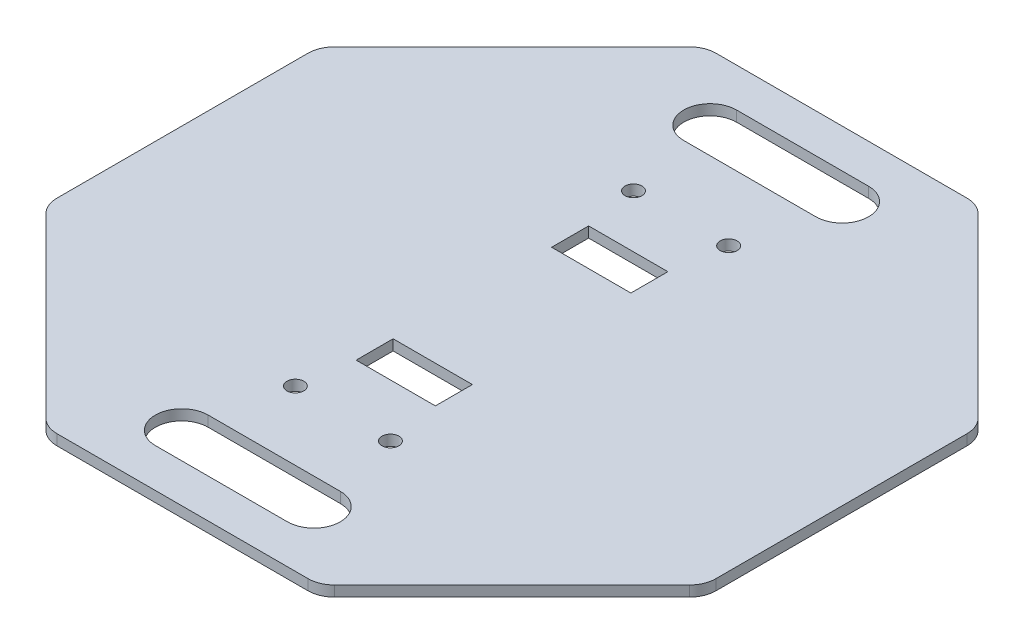
from build123d import *

# Parameters (mm, degrees)
SKETCH1_R           = 1.6
SKETCH1_W           = 15
SKETCH1_H           = 7
BOSS_EXTRUDE1_DEPTH = 2
FILLET1_R           = 5


with BuildPart() as part:
    # Sketch1 → Boss-Extrude1 (new body)
    with BuildSketch(Plane(origin=(0, 0, 0), x_dir=(1, 0, 0), z_dir=(0, 1, 0))):
        Polygon((62.361868445, -25.831131685), (62.361868445, 25.831131685), (25.831131685, 62.361868445), (-25.831131685, 62.361868445), (-62.361868445, 25.831131685), (-62.361868445, -25.831131685), (-25.831131685, -62.361868445), (25.831131685, -62.361868445), align=None)
        with Locations((-9, -32)):
            Circle(SKETCH1_R, mode=Mode.SUBTRACT)
        with BuildLine():
            ThreePointArc((12.5, -45), (17.5, -50), (12.5, -55))
            Line((12.5, -55), (-12.5, -55))
            ThreePointArc((-12.5, -55), (-17.5, -50), (-12.5, -45))
            Line((-12.5, -45), (12.5, -45))
        make_face(mode=Mode.SUBTRACT)
        with Locations((9, -32)):
            Circle(SKETCH1_R, mode=Mode.SUBTRACT)
        with Locations((0, -18.5)):
            Rectangle(SKETCH1_W, SKETCH1_H, mode=Mode.SUBTRACT)
        with Locations((-9, 32)):
            Circle(SKETCH1_R, mode=Mode.SUBTRACT)
        with Locations((0, 18.5)):
            Rectangle(SKETCH1_W, SKETCH1_H, mode=Mode.SUBTRACT)
        with Locations((9, 32)):
            Circle(SKETCH1_R, mode=Mode.SUBTRACT)
        with BuildLine():
            Line((-12.5, 55), (12.5, 55))
            ThreePointArc((12.5, 55), (17.5, 50), (12.5, 45))
            Line((12.5, 45), (-12.5, 45))
            ThreePointArc((-12.5, 45), (-17.5, 50), (-12.5, 55))
        make_face(mode=Mode.SUBTRACT)
    extrude(amount=BOSS_EXTRUDE1_DEPTH)

    # Fillet1
    fillet1_edges = [part.edges().sort_by_distance(p)[0] for p in [
        (-25.831131685, 1, 62.361868445),
        (-62.361868445, 1, 25.831131685),
        (-62.361868445, 1, -25.831131685),
        (-25.831131685, 1, -62.361868445),
        (25.831131685, 1, -62.361868445),
        (62.361868445, 1, -25.831131685),
        (62.361868445, 1, 25.831131685),
        (25.831131685, 1, 62.361868445),
    ]]
    fillet(fillet1_edges, radius=FILLET1_R)


solid = part.part
